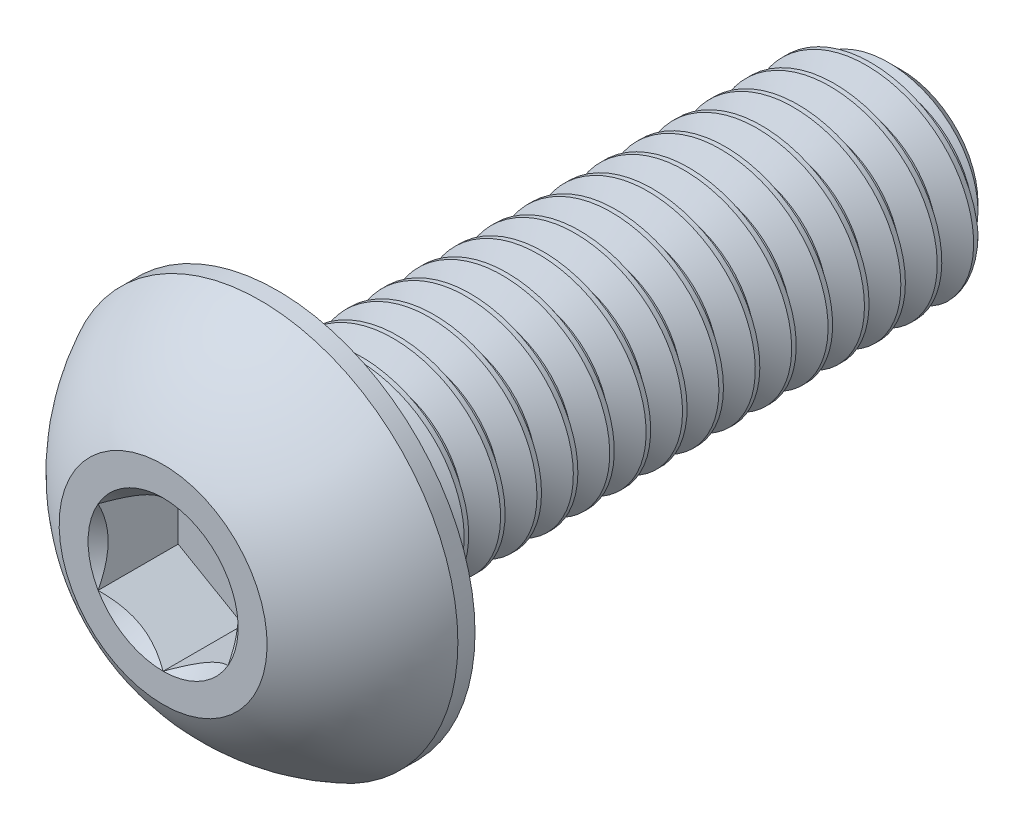
from build123d import *

# Parameters (mm, degrees)
CUT_EXTRUDE2_DEPTH = 1.54
CUT_SWEEP2_PITCH   = 0.7
CUT_SWEEP2_TO      = 12


with BuildPart() as part:
    # Sketch10 → Revolve3 (revolve)
    with BuildSketch(Plane(origin=(0, 0, 0), x_dir=(0, 0, -1), z_dir=(1, 0, 0)), mode=Mode.PRIVATE) as revolve3_sk:
        Polygon((13.675, 2), (14.2, 1.475), (14.2, 0), (2.2, 0), (2.2, 2), align=None)
    revolve(revolve3_sk.sketch.rotate(Axis((0, 0, 0), (0, 0, -1)), 90), axis=Axis((0, 0, 0), (0, 0, -1)))

    # Sketch7 → Revolve2 (revolve)
    with BuildSketch(Plane(origin=(0, 0, 0), x_dir=(0, 0, -1), z_dir=(1, 0, 0)), mode=Mode.PRIVATE) as revolve2_sk:
        with BuildLine():
            Line((1.87, 3.8), (2.2, 3.8))
            Line((2.2, 3.8), (2.2, 0))
            Line((2.2, 0), (0, 0))
            Line((0, 0), (0, 2))
            ThreePointArc((0, 2), (0.793500147, 3.047002626), (1.87, 3.8))
        make_face()
    revolve(revolve2_sk.sketch.rotate(Axis((0, 0, 0), (0, 0, -1)), 180), axis=Axis((0, 0, 0), (0, 0, -1)))

    # Sketch5 → Cut-Extrude2 (cut)
    with BuildSketch(Plane.XY):
        Polygon((1.25, -0.721687836), (1.25, 0.721687836), (0, 1.443375673), (-1.25, 0.721687836), (-1.25, -0.721687836), (0, -1.443375673), align=None)
    extrude(amount=-CUT_EXTRUDE2_DEPTH, mode=Mode.SUBTRACT)

    # Cut-Extrude3 cone 1 section (through the dimple's axis) → Cut-Extrude3 (revolve, cut)
    with BuildSketch(Plane(origin=(0, 0, 0), x_dir=(0, -1, 0), z_dir=(1, 0, 0))):
        Polygon((0, 0), (1.443375673, 0), (0, 1.443375673), align=None)
    revolve(axis=Axis((0, 0, 0), (0, 0, -1)), mode=Mode.SUBTRACT)


with BuildPart() as body_2:
    # Split1: read off the stored shape, not the designer's step
    # Split1: the piece on the far side of the plane
    add(part.part)
    split(bisect_by=Plane.XY.offset(-2.2), keep=Keep.BOTTOM)

    # Cut-Sweep2: arcs per turn and ends read off the stored shape
    # Cut-Sweep2: the profile of Sketch12 screwed along a right-hand helix through 22 turns, 6 arcs to a turn; built about Z, then put on its axis
    cut_sweep2_z = Axis((0, 0, 0), (0, 0, 1))
    cut_sweep2_corners = [(1.545336663, 0, -0.2625), (1.545336663, 0, -0.35), (2.037888611, 0, -0.634375), (2.037888611, 0, 0.021875)]
    with BuildLine(mode=Mode.PRIVATE) as cut_sweep2_profile:
        Line(cut_sweep2_corners[0], cut_sweep2_corners[1])
        Line(cut_sweep2_corners[1], cut_sweep2_corners[2])
        Line(cut_sweep2_corners[2], cut_sweep2_corners[3])
        Line(cut_sweep2_corners[3], cut_sweep2_corners[0])
    cut_sweep2_cap = Face(cut_sweep2_profile.wire())
    cut_sweep2_turn_angles = [0, 30, 60, 90, 120, 150, 180, 210, 240, 270, 300, 330, 360]
    cut_sweep2_turn_weights = [1, 0.8660254037844387, 1, 0.8660254037844387, 1, 0.8660254037844387, 1, 0.8660254037844387, 1, 0.8660254037844387, 1, 0.8660254037844387, 1]
    cut_sweep2_turn_rails = [Edge.make_bspline([Vector(p[0], p[1], 0).rotate(cut_sweep2_z, cut_sweep2_turn_angles[k]) / cut_sweep2_turn_weights[k] + Vector(0, 0, p[2] + CUT_SWEEP2_PITCH * cut_sweep2_turn_angles[k] / 360) for k in range(13)], [0, 0, 0, 1, 1, 2, 2, 3, 3, 4, 4, 5, 5, 6, 6, 6], 2, cut_sweep2_turn_weights) for p in cut_sweep2_corners]
    cut_sweep2_turn_sides = [Face.make_surface_from_curves(cut_sweep2_turn_rails[p[0]], cut_sweep2_turn_rails[p[1]]) for p in [(0, 1), (1, 2), (2, 3), (3, 0)]]
    cut_sweep2 = Plane(origin=(0, 0, -14.2), x_dir=(0, 1, 0), z_dir=(0, 0, 1)) * split(Solid(Shell([*[p.moved(Location((0, 0, CUT_SWEEP2_PITCH * i))) for i in range(22) for p in cut_sweep2_turn_sides], cut_sweep2_cap, cut_sweep2_cap.rotate(cut_sweep2_z, 7920).moved(Location((0, 0, CUT_SWEEP2_PITCH * 7920 / 360)))])), bisect_by=Plane.XY.offset(CUT_SWEEP2_TO), keep=Keep.BOTTOM, mode=Mode.PRIVATE)
    add(cut_sweep2, mode=Mode.SUBTRACT)


with BuildPart() as part_1:
    add(part.part)

    # Split1
    split(bisect_by=Plane.XY.offset(-2.2), keep=Keep.TOP)

    add(body_2.part)  # Boss-Extrude1 merges body 2
    # Boss-Extrude1 cone 1 section (through the dimple's axis) → Boss-Extrude1 (revolve)
    with BuildSketch(Plane(origin=(0, 0, -2.2), x_dir=(0, -1, 0), z_dir=(1, 0, 0))):
        Polygon((0, 0), (2, 0), (0, 2), align=None)
    revolve(axis=Axis((0, 0, -2.2), (0, 0, -1)))


solid = part_1.part
